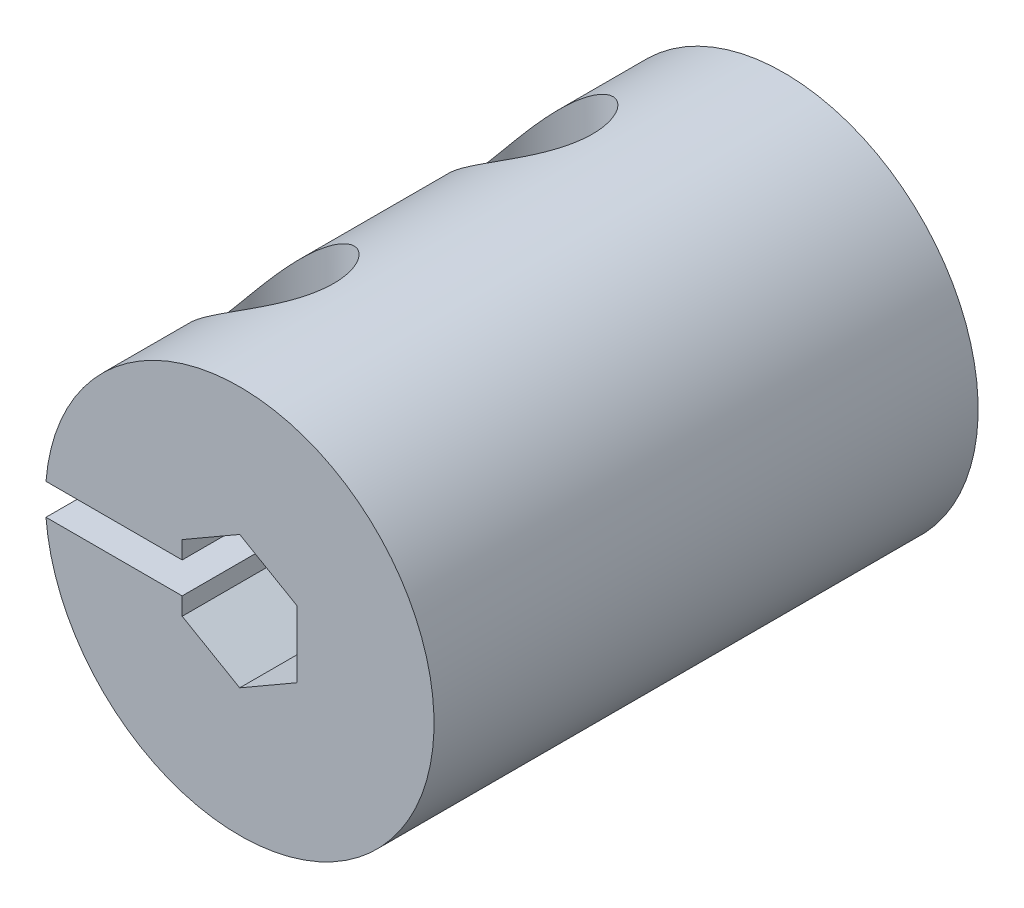
from build123d import *

# Parameters (mm, degrees)
BOSS_EXTRUDE1_DEPTH = 35
SKETCH2_R           = 1.8669
CUT_EXTRUDE1_DEPTH  = 45.791182168
SKETCH3_R           = 3.9497
CUT_EXTRUDE2_DEPTH  = 8
CUT_EXTRUDE3_DEPTH  = 8


with BuildPart() as part:
    # Sketch1 → Boss-Extrude1 (new body)
    with BuildSketch(Plane.XY):
        with BuildLine():
            ThreePointArc((12.5, 0), (0.500401124, 12.489979933), (-12.459935794, 1))
            Line((-12.459935794, 1), (-3.7, 1))
            Line((-3.7, 1), (-3.7, 2.136195996))
            Line((-3.7, 2.136195996), (0, 4.272391992))
            Line((0, 4.272391992), (3.7, 2.136195996))
            Line((3.7, 2.136195996), (3.7, -2.136195996))
            Line((3.7, -2.136195996), (0, -4.272391992))
            Line((0, -4.272391992), (-3.7, -2.136195996))
            Line((-3.7, -2.136195996), (-3.7, -1))
            Line((-3.7, -1), (-12.459935794, -1))
            ThreePointArc((-12.459935794, -1), (0.500401124, -12.489979933), (12.5, 0))
        make_face()
    extrude(amount=BOSS_EXTRUDE1_DEPTH)

    # Sketch2 → Cut-Extrude1 (cut, through all)
    with BuildSketch(Plane(origin=(0, 12.5, 0), x_dir=(1, 0, 0), z_dir=(0, 1, 0))):
        with Locations((-7.078786681, -9.175485886)):
            Circle(SKETCH2_R)
        with Locations((-7.078786681, -25.824514114)):
            Circle(SKETCH2_R)
    extrude(amount=-CUT_EXTRUDE1_DEPTH, mode=Mode.SUBTRACT)

    # Sketch3 → Cut-Extrude2 (cut)
    with BuildSketch(Plane(origin=(0, 12.5, 0), x_dir=(1, 0, 0), z_dir=(0, 1, 0))):
        with Locations((-7.078786681, -9.175485886)):
            Circle(SKETCH3_R)
        with Locations((-7.078786681, -25.824514114)):
            Circle(SKETCH3_R)
    extrude(amount=-CUT_EXTRUDE2_DEPTH, mode=Mode.SUBTRACT)

    # Sketch4 → Cut-Extrude3 (cut)
    with BuildSketch(Plane(origin=(0, -12.5, 0), x_dir=(-1, 0, 0), z_dir=(0, -1, 0))):
        Polygon((7.078786681, -5.230682437), (3.662486681, -7.203084162), (3.662486681, -11.147887611), (7.078786681, -13.120289335), (10.495086681, -11.147887611), (10.495086681, -7.203084162), align=None)
        Polygon((7.078786681, -21.879710665), (3.662486681, -23.852112389), (3.662486681, -27.796915838), (7.078786681, -29.769317563), (10.495086681, -27.796915838), (10.495086681, -23.852112389), align=None)
    extrude(amount=-CUT_EXTRUDE3_DEPTH, mode=Mode.SUBTRACT)


solid = part.part
